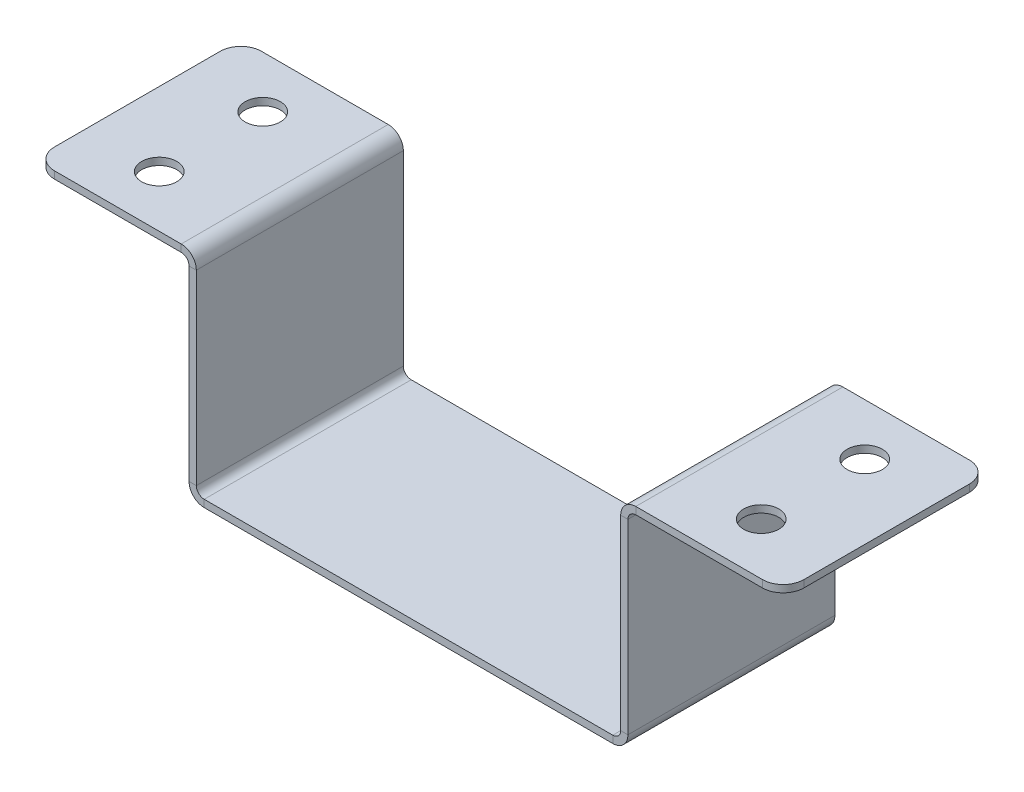
from build123d import *

# Parameters (mm, degrees)
SKETCH1_W                    = 41
SKETCH1_H                    = 20
BASE_FLANGE1_DEPTH           = 0.7
EDGE_FLANGE1_STRIP_W         = 4.324
EDGE_FLANGE1_STRIP_H         = 0.7
EDGE_FLANGE1_STRIP_CUT_DEPTH = 20
EDGE_FLANGE1_DEPTH           = 20
EDGE_FLANGE2_STRIP_W         = 4.324
EDGE_FLANGE2_STRIP_H         = 0.7
EDGE_FLANGE2_STRIP_CUT_DEPTH = 20
EDGE_FLANGE2_DEPTH           = 20
EDGE_FLANGE3_STRIP_W         = 4.324
EDGE_FLANGE3_STRIP_H         = 0.7
EDGE_FLANGE3_STRIP_CUT_DEPTH = 20
EDGE_FLANGE3_DEPTH           = 20
M3_CLEARANCE_HOLE1_D         = 3.4
M3_CLEARANCE_HOLE1_DEPTH     = 3
M3_CLEARANCE_HOLE1_TIP       = 1.021463052
FILLET1_R                    = 2


# Sheet-metal steps are written as plain solids
with BuildPart() as part:
    # Sketch1 → Base-Flange1 (new body)
    with BuildSketch(Plane(origin=(0, 0, 0), x_dir=(1, 0, 0), z_dir=(0, 1, 0))):
        with Locations((20.5, 10)):
            Rectangle(SKETCH1_W, SKETCH1_H)
    extrude(amount=-BASE_FLANGE1_DEPTH)

    # Edge-Flange1 strip (across the edge) → Edge-Flange1 strip cut (cut)
    with BuildSketch(Plane(origin=(41, 0, 0), x_dir=(-1, 0, 0), z_dir=(0, 0, -1))):
        with Locations((-1.4, -0.35)):
            Rectangle(EDGE_FLANGE1_STRIP_W, EDGE_FLANGE1_STRIP_H)
    extrude(amount=EDGE_FLANGE1_STRIP_CUT_DEPTH, mode=Mode.SUBTRACT)

    # Edge-Flange1 section (across the edge) → Edge-Flange1 (add)
    with BuildSketch(Plane(origin=(41, 0, 0), x_dir=(-1, 0, 0), z_dir=(0, 0, -1))):
        with BuildLine():
            Line((-0.7, 0.762), (-0.7, 20.25))
            Line((-0.7, 20.25), (0, 20.25))
            Line((0, 20.25), (0, 0.762))
            ThreePointArc((0, 0.762), (0.223184633, 0.223184633), (0.762, 0))
            Line((0.762, 0), (0.762, -0.7))
            ThreePointArc((0.762, -0.7), (-0.271790114, -0.271790114), (-0.7, 0.762))
        make_face()
    extrude(amount=EDGE_FLANGE1_DEPTH)

    # Edge-Flange2 strip (across the edge) → Edge-Flange2 strip cut (cut)
    with BuildSketch(Plane(origin=(41.7, 20.25, -20), x_dir=(0, -1, 0), z_dir=(0, 0, 1))):
        with Locations((-0.7, -0.35)):
            Rectangle(EDGE_FLANGE2_STRIP_W, EDGE_FLANGE2_STRIP_H)
    edge_flange2_strip_cut = extrude(amount=EDGE_FLANGE2_STRIP_CUT_DEPTH, mode=Mode.SUBTRACT)

    # Edge-Flange2 section (across the edge) → Edge-Flange2 (add)
    with BuildSketch(Plane(origin=(41.7, 20.25, -20), x_dir=(0, -1, 0), z_dir=(0, 0, 1))):
        with BuildLine():
            Line((0, 0.762), (0, 15))
            Line((0, 15), (0.7, 15))
            Line((0.7, 15), (0.7, 0.762))
            ThreePointArc((0.7, 0.762), (0.923184633, 0.223184633), (1.462, 0))
            Line((1.462, 0), (1.462, -0.7))
            ThreePointArc((1.462, -0.7), (0.428209886, -0.271790114), (0, 0.762))
        make_face()
    edge_flange2 = extrude(amount=EDGE_FLANGE2_DEPTH)

    # Edge-Flange3 strip (across the edge) → Edge-Flange3 strip cut (cut)
    with BuildSketch(Plane.XY.offset(-20)):
        with Locations((-1.4, -0.35)):
            Rectangle(EDGE_FLANGE3_STRIP_W, EDGE_FLANGE3_STRIP_H)
    extrude(amount=EDGE_FLANGE3_STRIP_CUT_DEPTH, mode=Mode.SUBTRACT)

    # Edge-Flange3 section (across the edge) → Edge-Flange3 (add)
    with BuildSketch(Plane.XY.offset(-20)):
        with BuildLine():
            Line((-0.7, 0.762), (-0.7, 20.25))
            Line((-0.7, 20.25), (0, 20.25))
            Line((0, 20.25), (0, 0.762))
            ThreePointArc((0, 0.762), (0.223184633, 0.223184633), (0.762, 0))
            Line((0.762, 0), (0.762, -0.7))
            ThreePointArc((0.762, -0.7), (-0.271790114, -0.271790114), (-0.7, 0.762))
        make_face()
    extrude(amount=EDGE_FLANGE3_DEPTH)

    # Mirror2: Edge-Flange2 strip cut, Edge-Flange2 across plane
    add(edge_flange2_strip_cut.mirror(Plane(origin=(20.5, 0, 0), x_dir=(0, 0, 1), z_dir=(1, 0, 0))), mode=Mode.SUBTRACT)
    add(edge_flange2.mirror(Plane(origin=(20.5, 0, 0), x_dir=(0, 0, 1), z_dir=(1, 0, 0))))

    # M3 Clearance Hole1
    with Locations(Plane(origin=(0, 20.25, 0), x_dir=(1, 0, 0), z_dir=(0, 1, 0))):
        with Locations((49.581, 5), (49.581, 15), (-8.581, 15), (-8.581, 5)):
            Hole(M3_CLEARANCE_HOLE1_D / 2, depth=M3_CLEARANCE_HOLE1_DEPTH)
            with Locations((0, 0, -(M3_CLEARANCE_HOLE1_DEPTH + M3_CLEARANCE_HOLE1_TIP / 2))):  # 118° drill point
                Cone(0, M3_CLEARANCE_HOLE1_D / 2, M3_CLEARANCE_HOLE1_TIP, mode=Mode.SUBTRACT)

    # Fillet1
    fillet1_edges = [part.edges().sort_by_distance(p)[0] for p in [
        (-15.7, 19.9, 0),
        (-15.7, 19.9, -20),
        (56.7, 19.9, -20),
        (56.7, 19.9, 0),
    ]]
    fillet(fillet1_edges, radius=FILLET1_R)


solid = part.part
